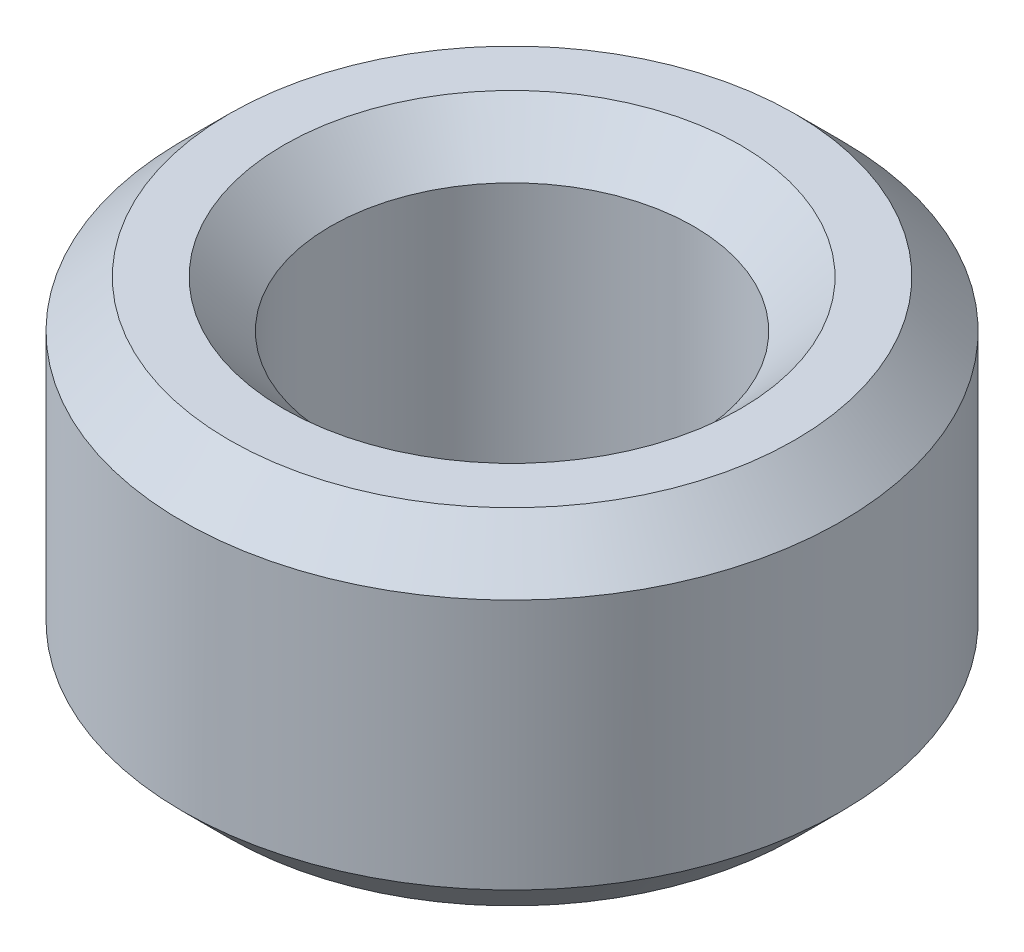
from build123d import *

# Parameters (mm, degrees)
SKETCH1_R           = 12.5
BOSS_EXTRUDE1_DEPTH = 13.078231837
SKETCH2_R           = 6.884928606
CUT_EXTRUDE1_DEPTH  = 22.989546334
CHAMFER1_SIZE       = 1.777950925


with BuildPart() as part:
    # Sketch1 → Boss-Extrude1 (new body)
    with BuildSketch(Plane(origin=(0, 0, 0), x_dir=(1, 0, 0), z_dir=(0, 1, 0))):
        Circle(SKETCH1_R)
    extrude(amount=BOSS_EXTRUDE1_DEPTH)

    # Sketch2 → Cut-Extrude1 (cut, through all)
    with BuildSketch(Plane(origin=(0, 0, 0), x_dir=(1, 0, 0), z_dir=(0, 1, 0))):
        Circle(SKETCH2_R)
    extrude(amount=CUT_EXTRUDE1_DEPTH, mode=Mode.SUBTRACT)

    # Chamfer1
    chamfer1_edges = [part.edges().sort_by_distance(p)[0] for p in [
        (-6.884928606, 13.078231837, 0),
        (-6.884928606, 0, 0),
        (-12.5, 0, 0),
        (-12.5, 13.078231837, 0),
    ]]
    chamfer(chamfer1_edges, length=CHAMFER1_SIZE)


solid = part.part
